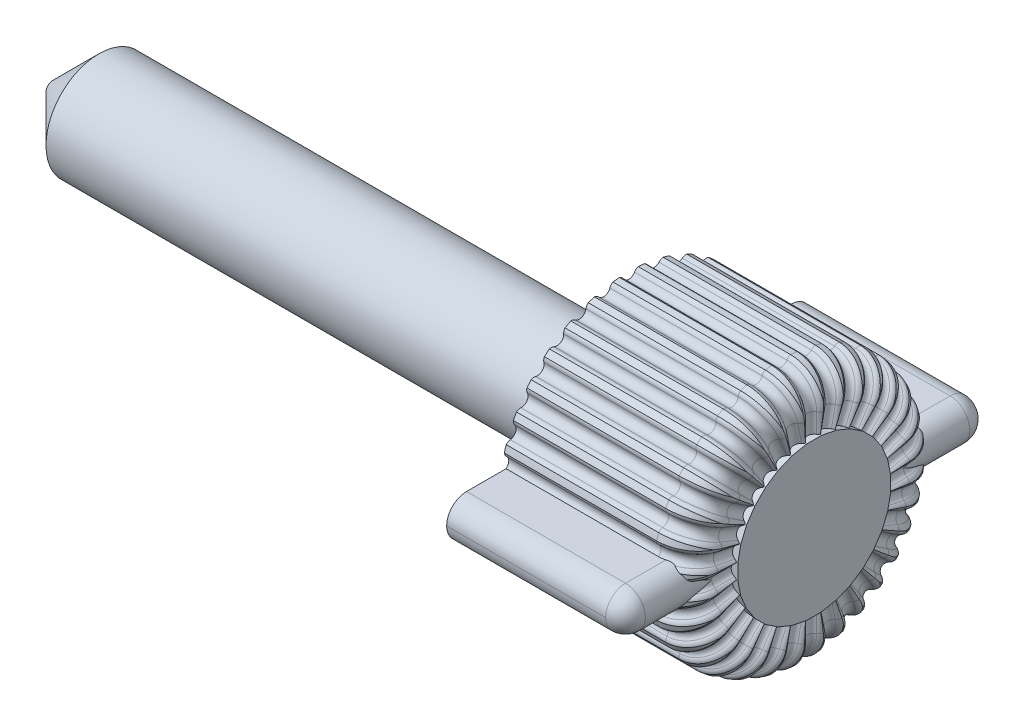
from build123d import *

# Parameters (mm, degrees)
CIRPATTERN1_COUNT   = 32
CHAMFER1_SIZE       = 1.778
BOSS_EXTRUDE1_DEPTH = 6.985
FILLET4_R           = 0.762
CUT_EXTRUDE1_REACH  = 27.124
SKETCH7_R           = 3.1750000000000007
SKETCH7_R_2         = 2.032


with BuildPart() as part:
    # Sketch1 → Base-Revolve (revolve)
    with BuildSketch(Plane.XY, mode=Mode.PRIVATE) as base_revolve_sk:
        with BuildLine():
            Line((0, 0), (0, 2.032))
            Line((0, 2.032), (23.621999999999996, 2.032))
            Line((23.621999999999996, 2.032), (23.621999999999996, 3.1750000000000007))
            Line((23.621999999999996, 3.1750000000000007), (22.097999999999995, 3.175))
            Line((22.097999999999995, 3.175), (22.097999999999995, 4.952999999999999))
            Line((22.097999999999995, 4.952999999999999), (27.939999999999998, 4.9529999999999985))
            ThreePointArc((27.939999999999998, 4.9529999999999985), (28.83802561210691, 4.581025612106911), (29.209999999999994, 3.6829999999999985))
            Line((29.209999999999994, 3.6829999999999985), (29.209999999999997, 0))
            Line((29.209999999999997, 0), (0, 0))
        make_face()
    revolve(base_revolve_sk.sketch.rotate(Axis((0, 0, 0), (1, 0, 0)), 90), axis=Axis((0, 0, 0), (1, 0, 0)))

    # Cut-Sweep1: sweep along a path in Sketch3
    with BuildLine(Plane.XY) as cut_sweep1_path:
        Line((28.95599999999999, 2.9300528112401807), (28.955999999999992, 3.6829999999999985))
        ThreePointArc((28.955999999999992, 3.6829999999999985), (28.658420489685525, 4.401420489685527), (27.939999999999998, 4.698999999999995))
        Line((27.939999999999998, 4.698999999999995), (22.097999999999995, 4.698999999999999))
    # Sketch4 → Cut-Sweep1 (sweep, cut)
    with BuildSketch(Plane(origin=(28.95599999999999, 2.9300528112401807, 0), x_dir=(1, -4.61e-15, 0), z_dir=(-4.61e-15, -1, 0))):
        with BuildLine():
            Line((0.2540000000000008, 0.43994090512249473), (0.2540000000000008, -0.4399409051224945))
            ThreePointArc((0.2540000000000008, -0.4399409051224945), (0.21997045256124798, -0.3129409051224942), (0.127, -0.21997045256124687))
            ThreePointArc((0.127, -0.21997045256124687), (1.1e-16, 2.6e-16), (0.12700000000000053, 0.219970452561247))
            ThreePointArc((0.12700000000000053, 0.219970452561247), (0.2199704525612481, 0.3129409051224946), (0.2540000000000008, 0.43994090512249473))
        make_face()
    cut_sweep1 = sweep(path=cut_sweep1_path.line, mode=Mode.SUBTRACT)

    # CirPattern1: Cut-Sweep1 ×32 about axis
    cirpattern1_axis = Axis((0, 4.4e-16, 5e-17), (1, 0, 0))
    for i in range(1, CIRPATTERN1_COUNT):
        add(cut_sweep1.rotate(cirpattern1_axis, i * 360 / CIRPATTERN1_COUNT), mode=Mode.SUBTRACT)

    # Chamfer1
    chamfer1_edges = [part.edges().sort_by_distance(p)[0] for p in [
        (0, -4.7e-16, -2.032),
    ]]
    chamfer(chamfer1_edges, length=CHAMFER1_SIZE)

    # Sketch6 → Boss-Extrude1 (add, symmetric)
    with BuildSketch(Plane.XY):
        with BuildLine():
            Line((22.097999999999995, 0.7619999999999997), (28.193999999999992, 0.7619999999999995))
            ThreePointArc((28.193999999999992, 0.7619999999999995), (28.955999999999992, -1.9e-16), (28.193999999999992, -0.7620000000000007))
            Line((28.193999999999992, -0.7620000000000007), (22.097999999999992, -0.7619999999999988))
            Line((22.097999999999992, -0.7619999999999988), (22.097999999999995, 0.7619999999999997))
        make_face()
    extrude(amount=BOSS_EXTRUDE1_DEPTH, both=True)

    # Fillet4
    fillet4_edges = [part.edges().sort_by_distance(p)[0] for p in [
        (25.145999999999994, -0.7619999999999998, 6.985),
        (28.955999999999992, -6.2e-16, 6.985),
        (25.145999999999994, 0.7619999999999996, 6.985),
        (25.145999999999994, 0.7619999999999996, -6.985),
        (28.955999999999992, -6.2e-16, -6.985),
        (25.145999999999994, -0.7619999999999998, -6.985),
    ]]
    fillet(fillet4_edges, radius=FILLET4_R - 0.0001)  # a hair under: the kernel refuses the full size

    # Sketch7 → Cut-Extrude1 (cut, up to next)
    with BuildSketch(Plane.ZY.offset(-23.621999999999996), mode=Mode.PRIVATE) as cut_extrude1_sk1:
        Circle(SKETCH7_R)
        Circle(SKETCH7_R_2, mode=Mode.SUBTRACT)
    cut_extrude1_tool1 = extrude(cut_extrude1_sk1.sketch, amount=CUT_EXTRUDE1_REACH, mode=Mode.PRIVATE) & part.part
    add(cut_extrude1_tool1.solids().sort_by_distance((23.622, 0, -3.085197))[0], mode=Mode.SUBTRACT)
    add(cut_extrude1_tool1.solids().sort_by_distance((23.622, 0, -3.085197))[1], mode=Mode.SUBTRACT)


solid = part.part
